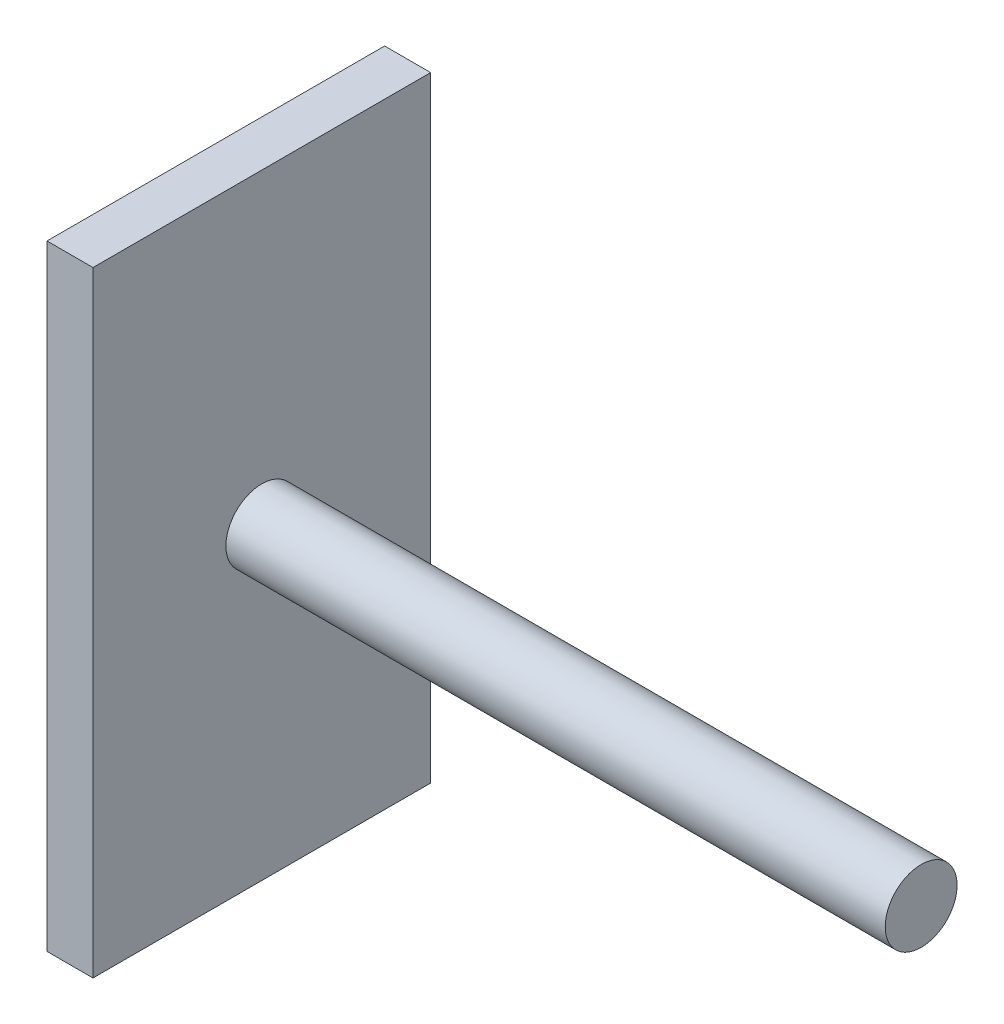
from build123d import *

# Parameters (mm, degrees)
ESQUISSE1_W        = 13.72
ESQUISSE1_H        = 25
BOSS_EXTRU_1_DEPTH = 1.87
ESQUISSE2_R        = 1.46
BOSS_EXTRU_2_DEPTH = 26.79


with BuildPart() as part:
    # Esquisse1 → Boss.-Extru.1 (new body)
    with BuildSketch(Plane(origin=(0, 0, 0), x_dir=(0, 0, -1), z_dir=(1, 0, 0))):
        with Locations((6.86, 12.5)):
            Rectangle(ESQUISSE1_W, ESQUISSE1_H)
    extrude(amount=BOSS_EXTRU_1_DEPTH)

    # Esquisse2 → Boss.-Extru.2 (add)
    with BuildSketch(Plane(origin=(1.87, 0, 0), x_dir=(0, 0, -1), z_dir=(1, 0, 0))):
        with Locations((6.86, 12.5)):
            Circle(ESQUISSE2_R)
    extrude(amount=BOSS_EXTRU_2_DEPTH)


solid = part.part
